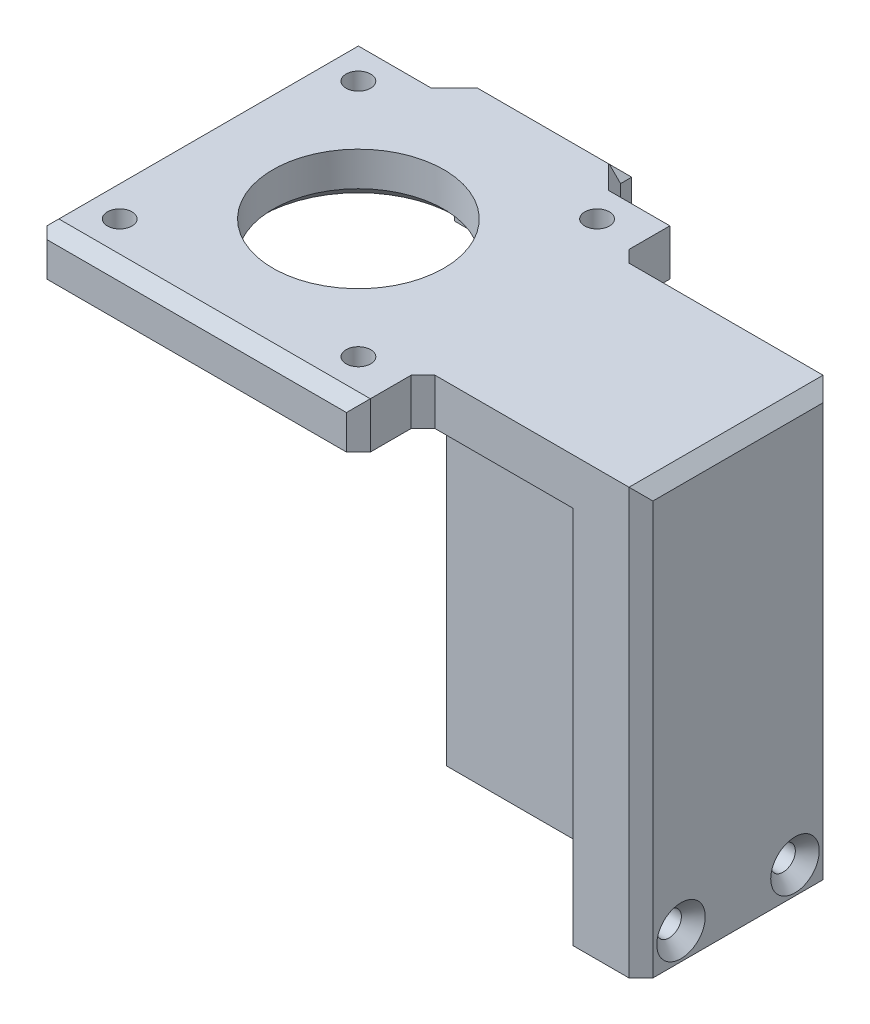
from build123d import *

# Parameters (mm, degrees)
BOSS_EXTRUDE1_DEPTH = 25.2
SKETCH2_R           = 1.6
BOSS_EXTRUDE2_DEPTH = 6
SKETCH3_W           = 19
SKETCH3_H           = 1
CUT_EXTRUDE1_DEPTH  = 38.2
CHAMFER2_SIZE       = 1.55
SKETCH4_R           = 11.1
CUT_EXTRUDE2_DEPTH  = 86.626222619
CHAMFER3_SIZE       = 1.55
CHAMFER4_SIZE       = 1
SKETCH5_R           = 1.6
CUT_EXTRUDE3_DEPTH  = 96.48869043
CHAMFER5_SIZE       = 1.55
BOSS_EXTRUDE3_START = -42
SKETCH6_W           = 20
SKETCH6_H           = 15
BOSS_EXTRUDE3_DEPTH = 3
SKETCH7_R           = 0.9
CUT_EXTRUDE4_DEPTH  = 95.097236941
CHAMFER7_SIZE       = 1.55
CHAMFER8_SIZE       = 1.55


with BuildPart() as part:
    # Sketch1 → Boss-Extrude1 (new body)
    with BuildSketch(Plane.XY):
        Polygon((0, 0), (0, 11), (-19, 11), (-19, 49.2), (8.8, 49.2), (8.8, 0), align=None)
    extrude(amount=BOSS_EXTRUDE1_DEPTH)

    # Sketch2 → Boss-Extrude2 (add)
    with BuildSketch(Plane(origin=(0, 49.2, 0), x_dir=(1, 0, 0), z_dir=(0, 1, 0))):
        Polygon((-61.5, 8.4), (-19.5, 8.4), (-19.5, 0), (8.8, 0), (8.8, -25.2), (-19.5, -25.2), (-19.5, -33.6), (-61.5, -33.6), align=None)
        with Locations(Location((-56, 2.9, 0), (0, 0, 180))):
            Circle(SKETCH2_R, mode=Mode.SUBTRACT)
        with Locations((-56, -28.1)):
            Circle(SKETCH2_R, mode=Mode.SUBTRACT)
        with Locations(Location((-25, -28.1, 0), (0, 0, 180))):
            Circle(SKETCH2_R, mode=Mode.SUBTRACT)
        with Locations((-25, 2.9)):
            Circle(SKETCH2_R, mode=Mode.SUBTRACT)
    extrude(amount=BOSS_EXTRUDE2_DEPTH)

    # Sketch3 → Cut-Extrude1 (cut)
    with BuildSketch(Plane.XZ.offset(-11)):
        with Locations((-9.5, 24.7)):
            Rectangle(SKETCH3_W, SKETCH3_H)
        with Locations((-9.5, 0.5)):
            Rectangle(SKETCH3_W, SKETCH3_H)
    extrude(amount=-CUT_EXTRUDE1_DEPTH, mode=Mode.SUBTRACT)

    # Chamfer2
    chamfer2_edges = [part.edges().sort_by_distance(p)[0] for p in [
        (-54.4, 49.2, -2.9),
        (-57.6, 49.2, 28.1),
        (-23.4, 49.2, 28.1),
        (-26.6, 49.2, -2.9),
    ]]
    chamfer(chamfer2_edges, length=CHAMFER2_SIZE)

    # Sketch4 → Cut-Extrude2 (cut, through all)
    with BuildSketch(Plane.XZ.offset(-49.2)):
        with Locations((-40.5, 12.6)):
            Circle(SKETCH4_R)
    extrude(amount=-CUT_EXTRUDE2_DEPTH, mode=Mode.SUBTRACT)

    # Chamfer3
    chamfer3_edges = [part.edges().sort_by_distance(p)[0] for p in [
        (8.8, 55.2, 12.6),
        (-61.5, 55.2, 12.6),
        (-19.5, 52.2, 0),
        (-19.5, 52.2, -8.4),
        (-61.5, 49.2, 12.6),
        (-61.5, 52.2, -8.4),
        (-61.5, 52.2, 33.6),
        (-19.5, 52.2, 33.6),
        (-19.5, 52.2, 25.2),
        (8.8, 27.6, 25.2),
        (-19, 30.1, 24.2),
        (-19, 30.1, 1),
        (8.8, 27.6, 0),
        (-51.6, 49.2, 12.6),
    ]]
    chamfer(chamfer3_edges, length=CHAMFER3_SIZE)

    # Chamfer4
    chamfer4_edges = [part.edges().sort_by_distance(p)[0] for p in [
        (0, 30.1, 24.2),
        (0, 30.1, 1),
    ]]
    chamfer(chamfer4_edges, length=CHAMFER4_SIZE - 0.0001)  # a hair under: the kernel refuses the full size

    # Sketch5 → Cut-Extrude3 (cut, through all)
    with BuildSketch(Plane(origin=(8.8, 0, 0), x_dir=(0, 0, -1), z_dir=(1, 0, 0))):
        with Locations((-5.2, 3.5)):
            Circle(SKETCH5_R)
        with Locations(Location((-20, 3.5, 0), (0, 0, 180))):
            Circle(SKETCH5_R)
    extrude(amount=-CUT_EXTRUDE3_DEPTH, mode=Mode.SUBTRACT)

    # Chamfer5
    chamfer5_edges = [part.edges().sort_by_distance(p)[0] for p in [
        (8.8, 3.5, 18.4),
        (8.8, 3.5, 6.8),
    ]]
    chamfer(chamfer5_edges, length=CHAMFER5_SIZE)

    # Sketch6 → Boss-Extrude3 (add)
    with BuildSketch(Plane.XY.offset(33.6).offset(BOSS_EXTRUDE3_START)):
        with Locations((-39, 47.7)):
            Rectangle(SKETCH6_W, SKETCH6_H)
    extrude(amount=-BOSS_EXTRUDE3_DEPTH)

    # Sketch7 → Cut-Extrude4 (cut, through all)
    with BuildSketch(Plane(origin=(0, 0, -11.4), x_dir=(-1, 0, 0), z_dir=(0, 0, -1))):
        with Locations((44, 45.2)):
            Circle(SKETCH7_R)
        with Locations((34, 45.2)):
            Circle(SKETCH7_R)
    extrude(amount=-CUT_EXTRUDE4_DEPTH, mode=Mode.SUBTRACT)

    # Chamfer7
    chamfer7_edges = [part.edges().sort_by_distance(p)[0] for p in [
        (-40.5, 55.2, 33.6),
        (-29, 55.2, -9.9),
        (-49, 55.2, -9.9),
        (-29, 52.2, -8.4),
        (-25.025, 55.2, -8.4),
        (-49, 52.2, -8.4),
        (-54.475, 55.2, -8.4),
    ]]
    chamfer(chamfer7_edges, length=CHAMFER7_SIZE)

    # Chamfer8
    chamfer8_edges = [part.edges().sort_by_distance(p)[0] for p in [
        (-39, 55.2, -11.4),
    ]]
    chamfer(chamfer8_edges, length=CHAMFER8_SIZE)


solid = part.part
